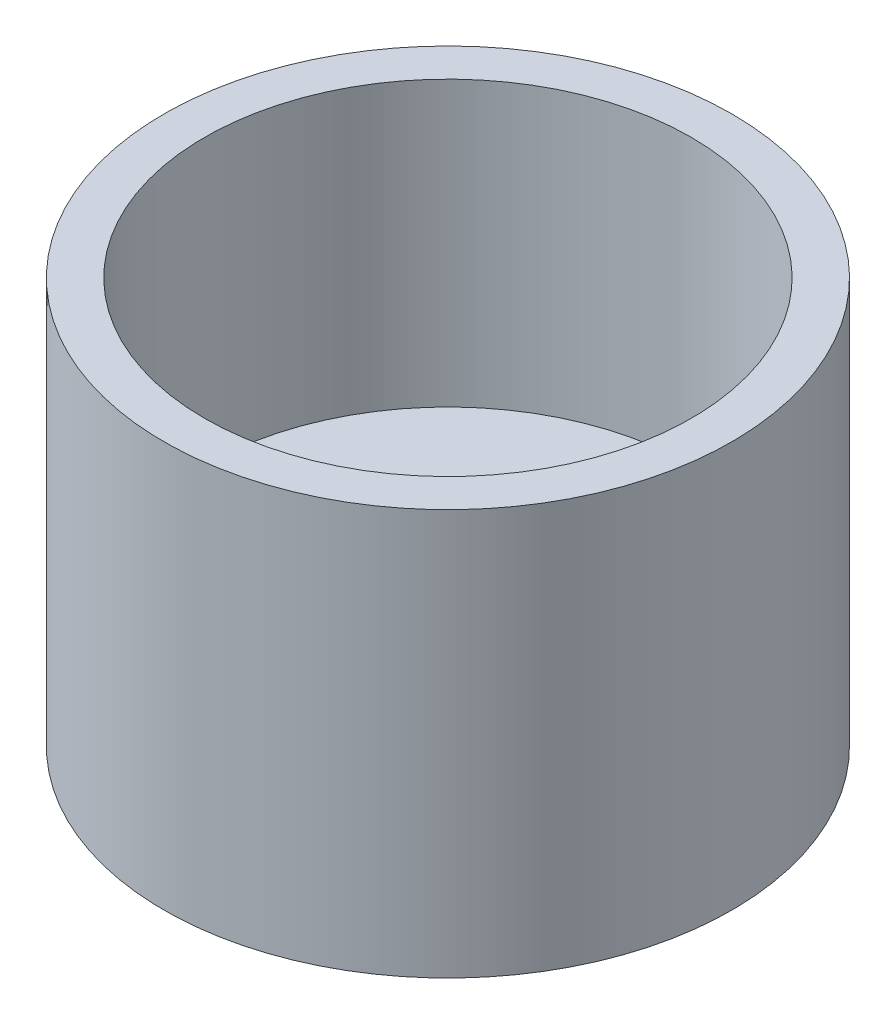
from build123d import *

# Parameters (mm, degrees)
SCHIZZO2_R               = 1
TAGLIO_ESTRUSIONE1_DEPTH = 10


with BuildPart() as part:
    # Schizzo1 → Rivoluzione1 (revolve)
    with BuildSketch(Plane.XY):
        Polygon((0, 0), (-14, 0), (-14, 20), (-12, 20), (-12, 6), (0, 6), align=None)
    revolve(axis=Axis((0, 0, 0), (0, 1, 0)))

    # Schizzo2 → Taglio-Estrusione1 (cut)
    with BuildSketch(Plane.XZ):
        Circle(SCHIZZO2_R)
    extrude(amount=-TAGLIO_ESTRUSIONE1_DEPTH, mode=Mode.SUBTRACT)


solid = part.part
